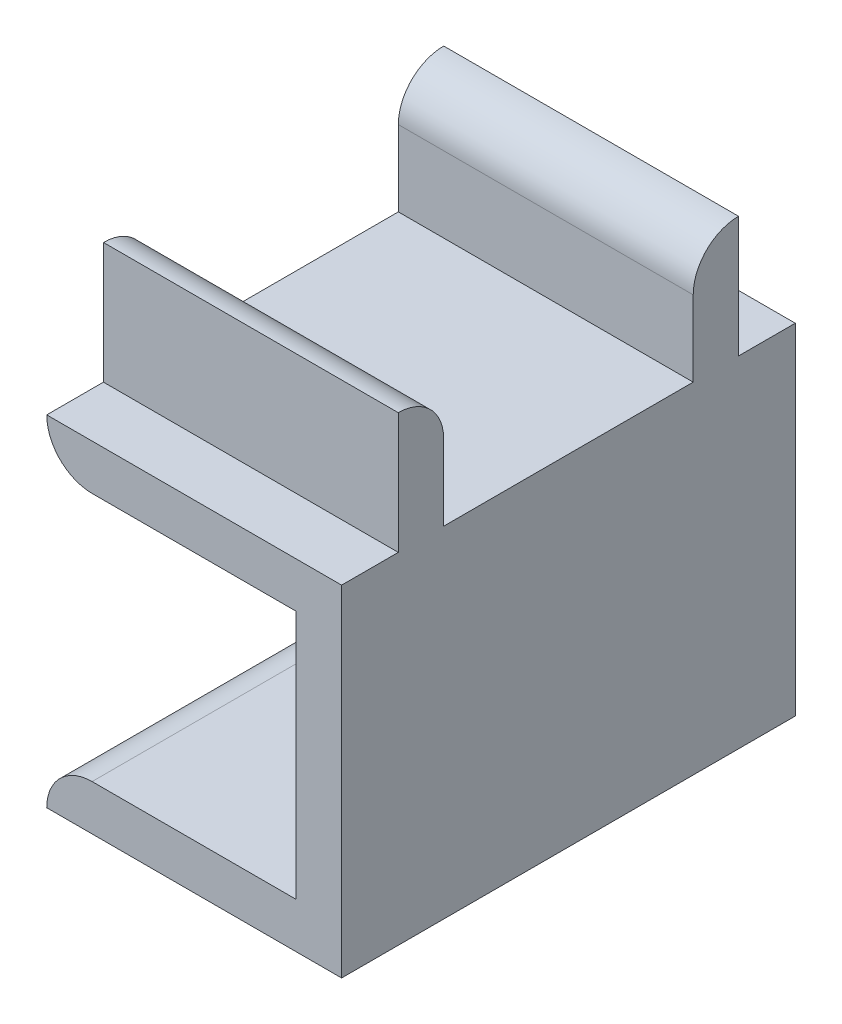
from build123d import *

# Parameters (mm, degrees)
BOSS_EXTRUDE1_DEPTH = 30
SKETCH2_W           = 19.5
SKETCH2_H           = 3
BOSS_EXTRUDE2_DEPTH = 8
FILLET1_R           = 3
FILLET2_R           = 3
FILLET3_R           = 3
FILLET4_R           = 3


with BuildPart() as part:
    # Sketch1 → Boss-Extrude1 (new body)
    with BuildSketch(Plane.XY):
        Polygon((0, 0), (0, 22.5), (-19.5, 22.5), (-19.5, 19.5), (-3, 19.5), (-3, 3), (-19.5, 3), (-19.5, 0), align=None)
    extrude(amount=BOSS_EXTRUDE1_DEPTH)

    # Sketch2 → Boss-Extrude2 (add)
    with BuildSketch(Plane(origin=(0, 22.5, 0), x_dir=(1, 0, 0), z_dir=(0, 1, 0))):
        with Locations((-9.75, -5.25)):
            Rectangle(SKETCH2_W, SKETCH2_H)
        with Locations((-9.75, -24.75)):
            Rectangle(SKETCH2_W, SKETCH2_H)
    extrude(amount=BOSS_EXTRUDE2_DEPTH)

    # Fillet1
    fillet1_edges = [part.edges().sort_by_distance(p)[0] for p in [
        (-9.75, 30.5, 6.75),
    ]]
    fillet(fillet1_edges, radius=FILLET1_R - 0.0001)  # a hair under: the kernel refuses the full size

    # Fillet2
    fillet2_edges = [part.edges().sort_by_distance(p)[0] for p in [
        (-9.75, 30.5, 23.25),
    ]]
    fillet(fillet2_edges, radius=FILLET2_R - 0.0001)  # a hair under: the kernel refuses the full size

    # Fillet3
    fillet3_edges = [part.edges().sort_by_distance(p)[0] for p in [
        (-19.5, 19.5, 15),
    ]]
    fillet(fillet3_edges, radius=FILLET3_R - 0.0001)  # a hair under: the kernel refuses the full size

    # Fillet4
    fillet4_edges = [part.edges().sort_by_distance(p)[0] for p in [
        (-19.5, 3, 15),
    ]]
    fillet(fillet4_edges, radius=FILLET4_R - 0.0001)  # a hair under: the kernel refuses the full size


solid = part.part
